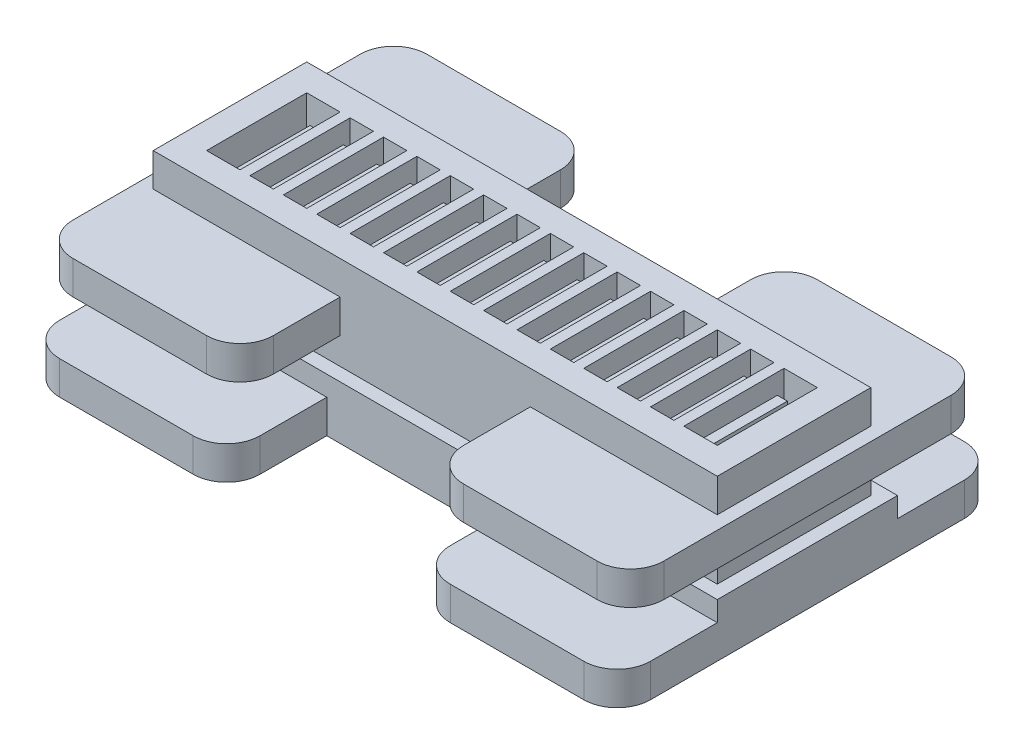
from build123d import *

# Parameters (mm, degrees)
SKETCH1_W            = 3.5
SKETCH1_H            = 15
BOSS_EXTRUDE1_DEPTH  = 15
SKETCH2_W            = 1.5
SKETCH2_H            = 11
CUT_EXTRUDE1_DEPTH   = 13
SKETCH3_W            = 15
SKETCH3_H            = 3
BOSS_EXTRUDE2_DEPTH  = 1.5
LPATTERN1_COUNT      = 15
LPATTERN1_PITCH      = 5
SKETCH4_W            = 15
SKETCH4_H            = 15
BOSS_EXTRUDE3_DEPTH  = 1.5
SKETCH5_W            = 15
SKETCH5_H            = 12
BOSS_EXTRUDE4_DEPTH  = 1.5
SKETCH7_W            = 68.5
SKETCH7_H            = 2
CUT_EXTRUDE2_DEPTH   = 2
SKETCH8_W            = 73.5
SKETCH8_H            = 13
SKETCH8_W_2          = 71.5
SKETCH8_H_2          = 11
BOSS_EXTRUDE5_DEPTH  = 2
SKETCH9_W            = 1.5
SKETCH9_H            = 2.5
BOSS_EXTRUDE6_DEPTH  = 2
LPATTERN2_COUNT      = 14
LPATTERN2_PITCH      = 5
SKETCH10_W           = 84.5
SKETCH10_H           = 23
BOSS_EXTRUDE7_DEPTH  = 22
SPLIT1_START         = -7
SPLIT1_OUTLINE_W     = 84.5
SPLIT1_OUTLINE_H     = 23
SPLIT1_DEPTH         = 7
SPLIT1_2_OUTLINE_W   = 1.5
SPLIT1_2_OUTLINE_H   = 11
SPLIT1_2_DEPTH       = 13
SPLIT1_3_OUTLINE_W   = 3.5
SPLIT1_3_OUTLINE_H   = 2
SPLIT1_3_DEPTH       = 2
SPLIT1_START_2       = -19
SPLIT1_4_DEPTH       = 23
SPLIT1_START_3       = -13
SPLIT1_5_DEPTH       = 11
SPLIT1_6_OUTLINE_W   = 73.5
SPLIT1_6_OUTLINE_H   = 2
SPLIT1_6_DEPTH       = 5
SPLIT1_START_4       = -1
SPLIT1_7_OUTLINE_W   = 73.5
SPLIT1_7_OUTLINE_H   = 2
SPLIT1_7_DEPTH       = 5
SPLIT1_START_5       = -8.5
SPLIT1_8_DEPTH       = 2
SPLIT1_START_6       = -9.5
SPLIT1_9_OUTLINE_W   = 1.5
SPLIT1_9_OUTLINE_H   = 2
SPLIT1_9_DEPTH       = 4
SPLIT1_10_OUTLINE_W  = 1.5
SPLIT1_10_OUTLINE_H  = 2
SPLIT1_10_DEPTH      = 1
SPLIT1_START_7       = -3
SPLIT1_11_OUTLINE_W  = 1.5
SPLIT1_11_OUTLINE_H  = 2
SPLIT1_11_DEPTH      = 1
SKETCH11_W           = 88.5
SKETCH11_H           = 27
SKETCH11_W_2         = 84.5
SKETCH11_H_2         = 23
BOSS_EXTRUDE8_DEPTH  = 8
SKETCH14_W           = 30
SKETCH14_H           = 15
BOSS_EXTRUDE9_DEPTH  = 5
FILLET1_R            = 5
SKETCH15_W           = 30
SKETCH15_H           = 5
BOSS_EXTRUDE10_DEPTH = 15
FILLET2_R            = 5
FILLET2_OF_MIRROR2_R = 5
BOSS_EXTRUDE11_REACH = 93.575
SKETCH16_W           = 2
SKETCH16_H           = 5


# Read off the part's stored shape, not the designer's step: Split1
with BuildPart() as part:
    # Sketch1 → Boss-Extrude1 (new body)
    with BuildSketch(Plane(origin=(0, 0, 0), x_dir=(1, 0, 0), z_dir=(0, 1, 0))):
        with Locations((1.75, 7.5)):
            Rectangle(SKETCH1_W, SKETCH1_H)
    extrude(amount=BOSS_EXTRUDE1_DEPTH)

    # Sketch2 → Cut-Extrude1 (cut)
    with BuildSketch(Plane.XZ):
        with Locations((1.75, -7.5)):
            Rectangle(SKETCH2_W, SKETCH2_H)
    extrude(amount=-CUT_EXTRUDE1_DEPTH, mode=Mode.SUBTRACT)

    # Sketch3 → Boss-Extrude2 (add)
    with BuildSketch(Plane.ZY):
        with Locations((-7.5, 1.5)):
            Rectangle(SKETCH3_W, SKETCH3_H)
    extrude(amount=BOSS_EXTRUDE2_DEPTH)


with BuildPart() as lpattern1_1:
    # LPattern1: pattern copy
    add(part.part.moved(Location(Vector(1, 0, 0) * (1 * LPATTERN1_PITCH))))


with BuildPart() as lpattern1_2:
    # LPattern1: pattern copy
    add(part.part.moved(Location(Vector(1, 0, 0) * (2 * LPATTERN1_PITCH))))


with BuildPart() as lpattern1_3:
    # LPattern1: pattern copy
    add(part.part.moved(Location(Vector(1, 0, 0) * (3 * LPATTERN1_PITCH))))


with BuildPart() as lpattern1_4:
    # LPattern1: pattern copy
    add(part.part.moved(Location(Vector(1, 0, 0) * (4 * LPATTERN1_PITCH))))


with BuildPart() as lpattern1_5:
    # LPattern1: pattern copy
    add(part.part.moved(Location(Vector(1, 0, 0) * (5 * LPATTERN1_PITCH))))


with BuildPart() as lpattern1_6:
    # LPattern1: pattern copy
    add(part.part.moved(Location(Vector(1, 0, 0) * (6 * LPATTERN1_PITCH))))


with BuildPart() as lpattern1_7:
    # LPattern1: pattern copy
    add(part.part.moved(Location(Vector(1, 0, 0) * (7 * LPATTERN1_PITCH))))


with BuildPart() as lpattern1_8:
    # LPattern1: pattern copy
    add(part.part.moved(Location(Vector(1, 0, 0) * (8 * LPATTERN1_PITCH))))


with BuildPart() as lpattern1_9:
    # LPattern1: pattern copy
    add(part.part.moved(Location(Vector(1, 0, 0) * (9 * LPATTERN1_PITCH))))


with BuildPart() as lpattern1_10:
    # LPattern1: pattern copy
    add(part.part.moved(Location(Vector(1, 0, 0) * (10 * LPATTERN1_PITCH))))


with BuildPart() as lpattern1_11:
    # LPattern1: pattern copy
    add(part.part.moved(Location(Vector(1, 0, 0) * (11 * LPATTERN1_PITCH))))


with BuildPart() as lpattern1_12:
    # LPattern1: pattern copy
    add(part.part.moved(Location(Vector(1, 0, 0) * (12 * LPATTERN1_PITCH))))


with BuildPart() as lpattern1_13:
    # LPattern1: pattern copy
    add(part.part.moved(Location(Vector(1, 0, 0) * (13 * LPATTERN1_PITCH))))


with BuildPart() as lpattern1_14:
    # LPattern1: pattern copy
    add(part.part.moved(Location(Vector(1, 0, 0) * (14 * LPATTERN1_PITCH))))


with BuildPart() as lpattern1_1_1:
    add(lpattern1_1.part)

    # Combine1: union LPattern1_2, LPattern1_3, LPattern1_4, LPattern1_5, LPattern1_6, LPattern1_7, LPattern1_8, LPattern1_9, LPattern1_10, LPattern1_11, LPattern1_12, LPattern1_13, LPattern1_14, part
    add(lpattern1_2.part)
    add(lpattern1_3.part)
    add(lpattern1_4.part)
    add(lpattern1_5.part)
    add(lpattern1_6.part)
    add(lpattern1_7.part)
    add(lpattern1_8.part)
    add(lpattern1_9.part)
    add(lpattern1_10.part)
    add(lpattern1_11.part)
    add(lpattern1_12.part)
    add(lpattern1_13.part)
    add(lpattern1_14.part)
    add(part.part)

    # Sketch4 → Boss-Extrude3 (add)
    with BuildSketch(Plane(origin=(73.5, 0, 0), x_dir=(0, 0, -1), z_dir=(1, 0, 0))):
        with Locations((7.5, 7.5)):
            Rectangle(SKETCH4_W, SKETCH4_H)
    extrude(amount=BOSS_EXTRUDE3_DEPTH)

    # Sketch5 → Boss-Extrude4 (add)
    with BuildSketch(Plane.ZY):
        with Locations((-7.5, 9)):
            Rectangle(SKETCH5_W, SKETCH5_H)
    extrude(amount=BOSS_EXTRUDE4_DEPTH)

    # Sketch7 → Cut-Extrude2 (cut)
    with BuildSketch(Plane.XZ):
        with Locations((36.75, -7.5)):
            Rectangle(SKETCH7_W, SKETCH7_H)
    extrude(amount=-CUT_EXTRUDE2_DEPTH, mode=Mode.SUBTRACT)

    # Sketch8 → Boss-Extrude5 (add)
    with BuildSketch(Plane(origin=(0, 0, 0), x_dir=(-1, 0, 0), z_dir=(0, -1, 0))):
        with Locations((-36.75, 7.5)):
            Rectangle(SKETCH8_W, SKETCH8_H)
        with Locations((-36.75, 7.5)):
            Rectangle(SKETCH8_W_2, SKETCH8_H_2, mode=Mode.SUBTRACT)
    extrude(amount=BOSS_EXTRUDE5_DEPTH)

    # Sketch9 → Boss-Extrude6 (add)
    with BuildSketch(Plane.XZ):
        with Locations((4.25, -4.25)):
            Rectangle(SKETCH9_W, SKETCH9_H)
        with Locations((4.25, -10.75)):
            Rectangle(SKETCH9_W, SKETCH9_H)
    boss_extrude6 = extrude(amount=BOSS_EXTRUDE6_DEPTH)

    # LPattern2: Boss-Extrude6 ×14
    with Locations(*[(i * LPATTERN2_PITCH, 0, 0) for i in range(1, LPATTERN2_COUNT)]):
        add(boss_extrude6)


with BuildPart() as body_2:
    # Sketch10 → Boss-Extrude7 (new body)
    with BuildSketch(Plane(origin=(0, 15, 0), x_dir=(1, 0, 0), z_dir=(0, 1, 0))):
        with Locations((36.75, 7.5)):
            Rectangle(SKETCH10_W, SKETCH10_H)
    extrude(amount=-BOSS_EXTRUDE7_DEPTH)

    # Combine2: cut LPattern1_1
    add(lpattern1_1_1.part, mode=Mode.SUBTRACT)

    # Split1 outline → Split1 (cut)
    with BuildSketch(Plane(origin=(0, 0, 0), x_dir=(1, 0, 0), z_dir=(0, 1, 0)).offset(SPLIT1_START)):
        with Locations((36.75, 7.5)):
            Rectangle(SPLIT1_OUTLINE_W, SPLIT1_OUTLINE_H)
    extrude(amount=SPLIT1_DEPTH, mode=Mode.SUBTRACT)

    # Split1 2 outline → Split1 2 (cut)
    with BuildSketch(Plane(origin=(0, 0, 0), x_dir=(1, 0, 0), z_dir=(0, 1, 0))):
        with Locations((71.75, 7.5)):
            Rectangle(SPLIT1_2_OUTLINE_W, SPLIT1_2_OUTLINE_H)
        with Locations((66.75, 7.5)):
            Rectangle(SPLIT1_2_OUTLINE_W, SPLIT1_2_OUTLINE_H)
        with Locations((61.75, 7.5)):
            Rectangle(SPLIT1_2_OUTLINE_W, SPLIT1_2_OUTLINE_H)
        with Locations((56.75, 7.5)):
            Rectangle(SPLIT1_2_OUTLINE_W, SPLIT1_2_OUTLINE_H)
        with Locations((51.75, 7.5)):
            Rectangle(SPLIT1_2_OUTLINE_W, SPLIT1_2_OUTLINE_H)
        with Locations((46.75, 7.5)):
            Rectangle(SPLIT1_2_OUTLINE_W, SPLIT1_2_OUTLINE_H)
        with Locations((41.75, 7.5)):
            Rectangle(SPLIT1_2_OUTLINE_W, SPLIT1_2_OUTLINE_H)
        with Locations((36.75, 7.5)):
            Rectangle(SPLIT1_2_OUTLINE_W, SPLIT1_2_OUTLINE_H)
        with Locations((31.75, 7.5)):
            Rectangle(SPLIT1_2_OUTLINE_W, SPLIT1_2_OUTLINE_H)
        with Locations((26.75, 7.5)):
            Rectangle(SPLIT1_2_OUTLINE_W, SPLIT1_2_OUTLINE_H)
        with Locations((21.75, 7.5)):
            Rectangle(SPLIT1_2_OUTLINE_W, SPLIT1_2_OUTLINE_H)
        with Locations((16.75, 7.5)):
            Rectangle(SPLIT1_2_OUTLINE_W, SPLIT1_2_OUTLINE_H)
        with Locations((11.75, 7.5)):
            Rectangle(SPLIT1_2_OUTLINE_W, SPLIT1_2_OUTLINE_H)
        with Locations((6.75, 7.5)):
            Rectangle(SPLIT1_2_OUTLINE_W, SPLIT1_2_OUTLINE_H)
        with Locations((1.75, 7.5)):
            Rectangle(SPLIT1_2_OUTLINE_W, SPLIT1_2_OUTLINE_H)
    extrude(amount=SPLIT1_2_DEPTH, mode=Mode.SUBTRACT)

    # Split1 3 outline → Split1 3 (cut)
    with BuildSketch(Plane(origin=(0, 0, 0), x_dir=(1, 0, 0), z_dir=(0, 1, 0))):
        with Locations((69.25, 7.5)):
            Rectangle(SPLIT1_3_OUTLINE_W, SPLIT1_3_OUTLINE_H)
        with Locations((64.25, 7.5)):
            Rectangle(SPLIT1_3_OUTLINE_W, SPLIT1_3_OUTLINE_H)
        with Locations((59.25, 7.5)):
            Rectangle(SPLIT1_3_OUTLINE_W, SPLIT1_3_OUTLINE_H)
        with Locations((54.25, 7.5)):
            Rectangle(SPLIT1_3_OUTLINE_W, SPLIT1_3_OUTLINE_H)
        with Locations((49.25, 7.5)):
            Rectangle(SPLIT1_3_OUTLINE_W, SPLIT1_3_OUTLINE_H)
        with Locations((44.25, 7.5)):
            Rectangle(SPLIT1_3_OUTLINE_W, SPLIT1_3_OUTLINE_H)
        with Locations((39.25, 7.5)):
            Rectangle(SPLIT1_3_OUTLINE_W, SPLIT1_3_OUTLINE_H)
        with Locations((34.25, 7.5)):
            Rectangle(SPLIT1_3_OUTLINE_W, SPLIT1_3_OUTLINE_H)
        with Locations((29.25, 7.5)):
            Rectangle(SPLIT1_3_OUTLINE_W, SPLIT1_3_OUTLINE_H)
        with Locations((24.25, 7.5)):
            Rectangle(SPLIT1_3_OUTLINE_W, SPLIT1_3_OUTLINE_H)
        with Locations((19.25, 7.5)):
            Rectangle(SPLIT1_3_OUTLINE_W, SPLIT1_3_OUTLINE_H)
        with Locations((14.25, 7.5)):
            Rectangle(SPLIT1_3_OUTLINE_W, SPLIT1_3_OUTLINE_H)
        with Locations((9.25, 7.5)):
            Rectangle(SPLIT1_3_OUTLINE_W, SPLIT1_3_OUTLINE_H)
        with Locations((4.25, 7.5)):
            Rectangle(SPLIT1_3_OUTLINE_W, SPLIT1_3_OUTLINE_H)
    extrude(amount=SPLIT1_3_DEPTH, mode=Mode.SUBTRACT)

    # Sketch15 → Boss-Extrude10 (add)
    with BuildSketch(Plane.XY.offset(4)):
        with Locations((7.5, 7.5)):
            Rectangle(SKETCH15_W, SKETCH15_H)
        with Locations((66, 7.5)):
            Rectangle(SKETCH15_W, SKETCH15_H)
    boss_extrude10 = extrude(amount=BOSS_EXTRUDE10_DEPTH)

    # Fillet2
    fillet2_edges = [body_2.edges().sort_by_distance(p)[0] for p in [
        (-7.5, 7.5, 19),
        (22.5, 7.5, 19),
        (51, 7.5, 19),
        (81, 7.5, 19),
    ]]
    fillet(fillet2_edges, radius=FILLET2_R)

    # Mirror2: Boss-Extrude10 across plane
    add(boss_extrude10.mirror(Plane(origin=(0, 0, -7.5), x_dir=(1, 0, 0), z_dir=(0, 0, -1))))

    # Fillet2 of Mirror2
    fillet2_of_mirror2_edges = [body_2.edges().sort_by_distance(p)[0] for p in [
        (-7.5, 7.5, -34),
        (22.5, 7.5, -34),
        (51, 7.5, -34),
        (81, 7.5, -34),
    ]]
    fillet(fillet2_of_mirror2_edges, radius=FILLET2_OF_MIRROR2_R)

    # Sketch16 → Boss-Extrude11 (add, up to next)
    with BuildSketch(Plane(origin=(0, 0, 4), x_dir=(-1, 0, 0), z_dir=(0, 0, -1)), mode=Mode.PRIVATE) as boss_extrude11_sk1:
        with Locations((-80, 7.5)):
            Rectangle(SKETCH16_W, SKETCH16_H)
    boss_extrude11_tool1 = extrude(boss_extrude11_sk1.sketch, amount=BOSS_EXTRUDE11_REACH, mode=Mode.PRIVATE) - body_2.part
    # Sketch16 → Boss-Extrude11 (add, up to next)
    with BuildSketch(Plane(origin=(0, 0, 4), x_dir=(-1, 0, 0), z_dir=(0, 0, -1)), mode=Mode.PRIVATE) as boss_extrude11_sk2:
        with Locations((6.5, 7.5)):
            Rectangle(SKETCH16_W, SKETCH16_H)
    boss_extrude11_tool2 = extrude(boss_extrude11_sk2.sketch, amount=BOSS_EXTRUDE11_REACH, mode=Mode.PRIVATE) - body_2.part
    add(boss_extrude11_tool1.solids().sort_by_distance((80, 7.5, 4))[0])
    add(boss_extrude11_tool2.solids().sort_by_distance((-6.5, 7.5, 4))[0])


with BuildPart() as body_2_2:
    # Split1 4 outline → Split1 4 (new body)
    with BuildSketch(Plane.XY.offset(SPLIT1_START_2)):
        Polygon((73.5, -2), (0, -2), (0, 0), (-5.5, 0), (-5.5, -7), (79, -7), (79, 0), (73.5, 0), align=None)
    extrude(amount=SPLIT1_4_DEPTH)

    # Split1 5 outline → Split1 5 (add)
    with BuildSketch(Plane.XY.offset(SPLIT1_START_3)):
        Polygon((67.5, 0), (67.5, 13), (66, 13), (66, 0), (65, 0), (65, -2), (68.5, -2), (68.5, 0), align=None)
        Polygon((71, 13), (71, 0), (70, 0), (70, -2), (72.5, -2), (72.5, 13), align=None)
        Polygon((62.5, 0), (62.5, 13), (61, 13), (61, 0), (60, 0), (60, -2), (63.5, -2), (63.5, 0), align=None)
        Polygon((55, -2), (58.5, -2), (58.5, 0), (57.5, 0), (57.5, 13), (56, 13), (56, 0), (55, 0), align=None)
        Polygon((50, -2), (53.5, -2), (53.5, 0), (52.5, 0), (52.5, 13), (51, 13), (51, 0), (50, 0), align=None)
        Polygon((3.5, 0), (2.5, 0), (2.5, 13), (1, 13), (1, -2), (3.5, -2), align=None)
        Polygon((45, -2), (48.5, -2), (48.5, 0), (47.5, 0), (47.5, 13), (46, 13), (46, 0), (45, 0), align=None)
        Polygon((5, 0), (5, -2), (8.5, -2), (8.5, 0), (7.5, 0), (7.5, 13), (6, 13), (6, 0), align=None)
        Polygon((40, -2), (43.5, -2), (43.5, 0), (42.5, 0), (42.5, 13), (41, 13), (41, 0), (40, 0), align=None)
        Polygon((10, 0), (10, -2), (13.5, -2), (13.5, 0), (12.5, 0), (12.5, 13), (11, 13), (11, 0), align=None)
        Polygon((35, -2), (38.5, -2), (38.5, 0), (37.5, 0), (37.5, 13), (36, 13), (36, 0), (35, 0), align=None)
        Polygon((15, 0), (15, -2), (18.5, -2), (18.5, 0), (17.5, 0), (17.5, 13), (16, 13), (16, 0), align=None)
        Polygon((30, -2), (33.5, -2), (33.5, 0), (32.5, 0), (32.5, 13), (31, 13), (31, 0), (30, 0), align=None)
        Polygon((20, 0), (20, -2), (23.5, -2), (23.5, 0), (22.5, 0), (22.5, 13), (21, 13), (21, 0), align=None)
        Polygon((25, -2), (28.5, -2), (28.5, 0), (27.5, 0), (27.5, 13), (26, 13), (26, 0), (25, 0), align=None)
    extrude(amount=SPLIT1_5_DEPTH)

    # Split1 6 outline → Split1 6 (add)
    with BuildSketch(Plane.XY.offset(SPLIT1_START_2)):
        with Locations((36.75, -1)):
            Rectangle(SPLIT1_6_OUTLINE_W, SPLIT1_6_OUTLINE_H)
    extrude(amount=SPLIT1_6_DEPTH)

    # Split1 7 outline → Split1 7 (add)
    with BuildSketch(Plane.XY.offset(SPLIT1_START_4)):
        with Locations((36.75, -1)):
            Rectangle(SPLIT1_7_OUTLINE_W, SPLIT1_7_OUTLINE_H)
    extrude(amount=SPLIT1_7_DEPTH)

    # Split1 8 outline → Split1 8 (add)
    with BuildSketch(Plane.XY.offset(SPLIT1_START_5)):
        Polygon((71, 2), (67.5, 2), (67.5, 0), (68.5, 0), (68.5, -2), (70, -2), (70, 0), (71, 0), align=None)
        Polygon((65, 0), (66, 0), (66, 2), (62.5, 2), (62.5, 0), (63.5, 0), (63.5, -2), (65, -2), align=None)
        Polygon((58.5, -2), (60, -2), (60, 0), (61, 0), (61, 2), (57.5, 2), (57.5, 0), (58.5, 0), align=None)
        Polygon((53.5, -2), (55, -2), (55, 0), (56, 0), (56, 2), (52.5, 2), (52.5, 0), (53.5, 0), align=None)
        Polygon((48.5, -2), (50, -2), (50, 0), (51, 0), (51, 2), (47.5, 2), (47.5, 0), (48.5, 0), align=None)
        Polygon((2.5, 2), (2.5, 0), (3.5, 0), (3.5, -2), (5, -2), (5, 0), (6, 0), (6, 2), align=None)
        Polygon((43.5, -2), (45, -2), (45, 0), (46, 0), (46, 2), (42.5, 2), (42.5, 0), (43.5, 0), align=None)
        Polygon((8.5, 0), (8.5, -2), (10, -2), (10, 0), (11, 0), (11, 2), (7.5, 2), (7.5, 0), align=None)
        Polygon((38.5, -2), (40, -2), (40, 0), (41, 0), (41, 2), (37.5, 2), (37.5, 0), (38.5, 0), align=None)
        Polygon((13.5, 0), (13.5, -2), (15, -2), (15, 0), (16, 0), (16, 2), (12.5, 2), (12.5, 0), align=None)
        Polygon((33.5, -2), (35, -2), (35, 0), (36, 0), (36, 2), (32.5, 2), (32.5, 0), (33.5, 0), align=None)
        Polygon((18.5, 0), (18.5, -2), (20, -2), (20, 0), (21, 0), (21, 2), (17.5, 2), (17.5, 0), align=None)
        Polygon((28.5, -2), (30, -2), (30, 0), (31, 0), (31, 2), (27.5, 2), (27.5, 0), (28.5, 0), align=None)
        Polygon((23.5, 0), (23.5, -2), (25, -2), (25, 0), (26, 0), (26, 2), (22.5, 2), (22.5, 0), align=None)
    extrude(amount=SPLIT1_8_DEPTH)

    # Split1 9 outline → Split1 9 (add)
    with BuildSketch(Plane.XY.offset(SPLIT1_START_6)):
        with Locations((69.25, -1)):
            Rectangle(SPLIT1_9_OUTLINE_W, SPLIT1_9_OUTLINE_H)
        with Locations((64.25, -1)):
            Rectangle(SPLIT1_9_OUTLINE_W, SPLIT1_9_OUTLINE_H)
        with Locations((59.25, -1)):
            Rectangle(SPLIT1_9_OUTLINE_W, SPLIT1_9_OUTLINE_H)
        with Locations((54.25, -1)):
            Rectangle(SPLIT1_9_OUTLINE_W, SPLIT1_9_OUTLINE_H)
        with Locations((49.25, -1)):
            Rectangle(SPLIT1_9_OUTLINE_W, SPLIT1_9_OUTLINE_H)
        with Locations((4.25, -1)):
            Rectangle(SPLIT1_9_OUTLINE_W, SPLIT1_9_OUTLINE_H)
        with Locations((44.25, -1)):
            Rectangle(SPLIT1_9_OUTLINE_W, SPLIT1_9_OUTLINE_H)
        with Locations((9.25, -1)):
            Rectangle(SPLIT1_9_OUTLINE_W, SPLIT1_9_OUTLINE_H)
        with Locations((39.25, -1)):
            Rectangle(SPLIT1_9_OUTLINE_W, SPLIT1_9_OUTLINE_H)
        with Locations((14.25, -1)):
            Rectangle(SPLIT1_9_OUTLINE_W, SPLIT1_9_OUTLINE_H)
        with Locations((34.25, -1)):
            Rectangle(SPLIT1_9_OUTLINE_W, SPLIT1_9_OUTLINE_H)
        with Locations((19.25, -1)):
            Rectangle(SPLIT1_9_OUTLINE_W, SPLIT1_9_OUTLINE_H)
        with Locations((29.25, -1)):
            Rectangle(SPLIT1_9_OUTLINE_W, SPLIT1_9_OUTLINE_H)
        with Locations((24.25, -1)):
            Rectangle(SPLIT1_9_OUTLINE_W, SPLIT1_9_OUTLINE_H)
    extrude(amount=SPLIT1_9_DEPTH)

    # Split1 10 outline → Split1 10 (add)
    with BuildSketch(Plane.XY.offset(SPLIT1_START_3)):
        with Locations((69.25, -1)):
            Rectangle(SPLIT1_10_OUTLINE_W, SPLIT1_10_OUTLINE_H)
        with Locations((64.25, -1)):
            Rectangle(SPLIT1_10_OUTLINE_W, SPLIT1_10_OUTLINE_H)
        with Locations((59.25, -1)):
            Rectangle(SPLIT1_10_OUTLINE_W, SPLIT1_10_OUTLINE_H)
        with Locations((54.25, -1)):
            Rectangle(SPLIT1_10_OUTLINE_W, SPLIT1_10_OUTLINE_H)
        with Locations((49.25, -1)):
            Rectangle(SPLIT1_10_OUTLINE_W, SPLIT1_10_OUTLINE_H)
        with Locations((4.25, -1)):
            Rectangle(SPLIT1_10_OUTLINE_W, SPLIT1_10_OUTLINE_H)
        with Locations((44.25, -1)):
            Rectangle(SPLIT1_10_OUTLINE_W, SPLIT1_10_OUTLINE_H)
        with Locations((9.25, -1)):
            Rectangle(SPLIT1_10_OUTLINE_W, SPLIT1_10_OUTLINE_H)
        with Locations((39.25, -1)):
            Rectangle(SPLIT1_10_OUTLINE_W, SPLIT1_10_OUTLINE_H)
        with Locations((14.25, -1)):
            Rectangle(SPLIT1_10_OUTLINE_W, SPLIT1_10_OUTLINE_H)
        with Locations((34.25, -1)):
            Rectangle(SPLIT1_10_OUTLINE_W, SPLIT1_10_OUTLINE_H)
        with Locations((19.25, -1)):
            Rectangle(SPLIT1_10_OUTLINE_W, SPLIT1_10_OUTLINE_H)
        with Locations((29.25, -1)):
            Rectangle(SPLIT1_10_OUTLINE_W, SPLIT1_10_OUTLINE_H)
        with Locations((24.25, -1)):
            Rectangle(SPLIT1_10_OUTLINE_W, SPLIT1_10_OUTLINE_H)
    extrude(amount=SPLIT1_10_DEPTH)

    # Split1 11 outline → Split1 11 (add)
    with BuildSketch(Plane.XY.offset(SPLIT1_START_7)):
        with Locations((69.25, -1)):
            Rectangle(SPLIT1_11_OUTLINE_W, SPLIT1_11_OUTLINE_H)
        with Locations((64.25, -1)):
            Rectangle(SPLIT1_11_OUTLINE_W, SPLIT1_11_OUTLINE_H)
        with Locations((59.25, -1)):
            Rectangle(SPLIT1_11_OUTLINE_W, SPLIT1_11_OUTLINE_H)
        with Locations((54.25, -1)):
            Rectangle(SPLIT1_11_OUTLINE_W, SPLIT1_11_OUTLINE_H)
        with Locations((49.25, -1)):
            Rectangle(SPLIT1_11_OUTLINE_W, SPLIT1_11_OUTLINE_H)
        with Locations((4.25, -1)):
            Rectangle(SPLIT1_11_OUTLINE_W, SPLIT1_11_OUTLINE_H)
        with Locations((44.25, -1)):
            Rectangle(SPLIT1_11_OUTLINE_W, SPLIT1_11_OUTLINE_H)
        with Locations((9.25, -1)):
            Rectangle(SPLIT1_11_OUTLINE_W, SPLIT1_11_OUTLINE_H)
        with Locations((39.25, -1)):
            Rectangle(SPLIT1_11_OUTLINE_W, SPLIT1_11_OUTLINE_H)
        with Locations((14.25, -1)):
            Rectangle(SPLIT1_11_OUTLINE_W, SPLIT1_11_OUTLINE_H)
        with Locations((34.25, -1)):
            Rectangle(SPLIT1_11_OUTLINE_W, SPLIT1_11_OUTLINE_H)
        with Locations((19.25, -1)):
            Rectangle(SPLIT1_11_OUTLINE_W, SPLIT1_11_OUTLINE_H)
        with Locations((29.25, -1)):
            Rectangle(SPLIT1_11_OUTLINE_W, SPLIT1_11_OUTLINE_H)
        with Locations((24.25, -1)):
            Rectangle(SPLIT1_11_OUTLINE_W, SPLIT1_11_OUTLINE_H)
    extrude(amount=SPLIT1_11_DEPTH)

    # Sketch11 → Boss-Extrude8 (add)
    with BuildSketch(Plane.XZ.offset(7)):
        with Locations((36.75, -7.5)):
            Rectangle(SKETCH11_W, SKETCH11_H)
        with Locations((36.75, -7.5)):
            Rectangle(SKETCH11_W_2, SKETCH11_H_2, mode=Mode.SUBTRACT)
    extrude(amount=-BOSS_EXTRUDE8_DEPTH)

    # Sketch14 → Boss-Extrude9 (add)
    with BuildSketch(Plane.XZ.offset(7)):
        with Locations((7.5, 13.5)):
            Rectangle(SKETCH14_W, SKETCH14_H)
        with Locations((66, 13.5)):
            Rectangle(SKETCH14_W, SKETCH14_H)
        with Locations((66, -28.5)):
            Rectangle(SKETCH14_W, SKETCH14_H)
        with Locations((7.5, -28.5)):
            Rectangle(SKETCH14_W, SKETCH14_H)
    extrude(amount=-BOSS_EXTRUDE9_DEPTH)

    # Fillet1
    fillet1_edges = [body_2_2.edges().sort_by_distance(p)[0] for p in [
        (-7.5, -4.5, 21),
        (22.5, -4.5, 21),
        (81, -4.5, 21),
        (51, -4.5, 21),
        (81, -4.5, -36),
        (51, -4.5, -36),
        (-7.5, -4.5, -36),
        (22.5, -4.5, -36),
    ]]
    fillet(fillet1_edges, radius=FILLET1_R)


solid = Compound([body_2.part, body_2_2.part])
